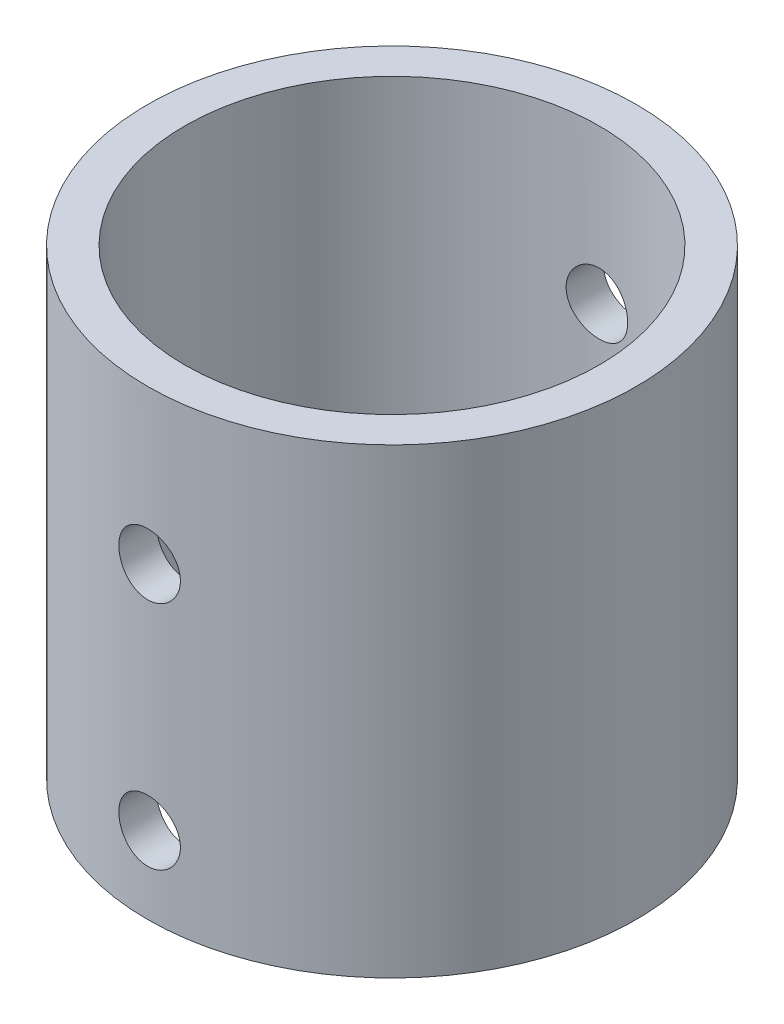
from build123d import *

# Parameters (mm, degrees)
SKETCH1_R               = 15.875
SKETCH1_R_2             = 13.462
BOSS_EXTRUDE1_DEPTH     = 30
CUT_EXTRUDE1_DEPTH      = 30
CUT_EXTRUDE1_DEPTH_BACK = 30
SKETCH2_R               = 2


with BuildPart() as part:
    # Sketch1 → Boss-Extrude1 (new body)
    with BuildSketch(Plane(origin=(0, 0, 0), x_dir=(1, 0, 0), z_dir=(0, 1, 0))):
        Circle(SKETCH1_R)
        Circle(SKETCH1_R_2, mode=Mode.SUBTRACT)
    extrude(amount=-BOSS_EXTRUDE1_DEPTH)

    # Sketch2 → Cut-Extrude1 (cut, two sides: drawn at the far end of the back side and taken through both)
    with BuildSketch(Plane.XY.offset(-CUT_EXTRUDE1_DEPTH_BACK)):
        with Locations((0, -25)):
            Circle(SKETCH2_R)
        with Locations((0, -10)):
            Circle(SKETCH2_R)
    extrude(amount=CUT_EXTRUDE1_DEPTH + CUT_EXTRUDE1_DEPTH_BACK, mode=Mode.SUBTRACT)


solid = part.part
